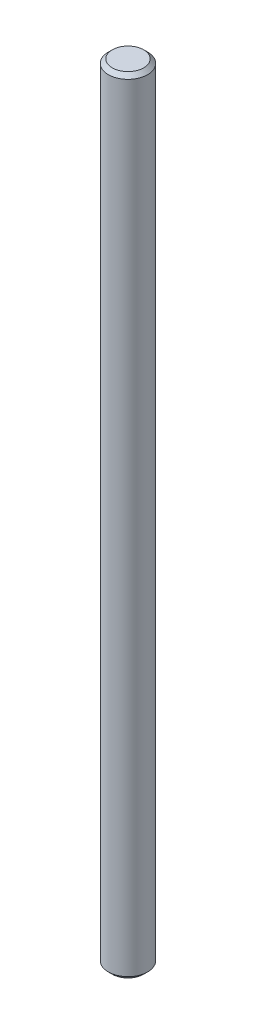
from build123d import *

# Parameters (mm, degrees)
SKETCH1_R           = 5
BOSS_EXTRUDE1_DEPTH = 200
CHAMFER1_SIZE       = 1


with BuildPart() as part:
    # Sketch1 → Boss-Extrude1 (new body)
    with BuildSketch(Plane(origin=(0, 0, 0), x_dir=(1, 0, 0), z_dir=(0, 1, 0))):
        Circle(SKETCH1_R)
    extrude(amount=BOSS_EXTRUDE1_DEPTH)

    # Chamfer1
    chamfer1_edges = [part.edges().sort_by_distance(p)[0] for p in [
        (-5, 0, 0),
        (-5, 200, 0),
    ]]
    chamfer(chamfer1_edges, length=CHAMFER1_SIZE)


solid = part.part
